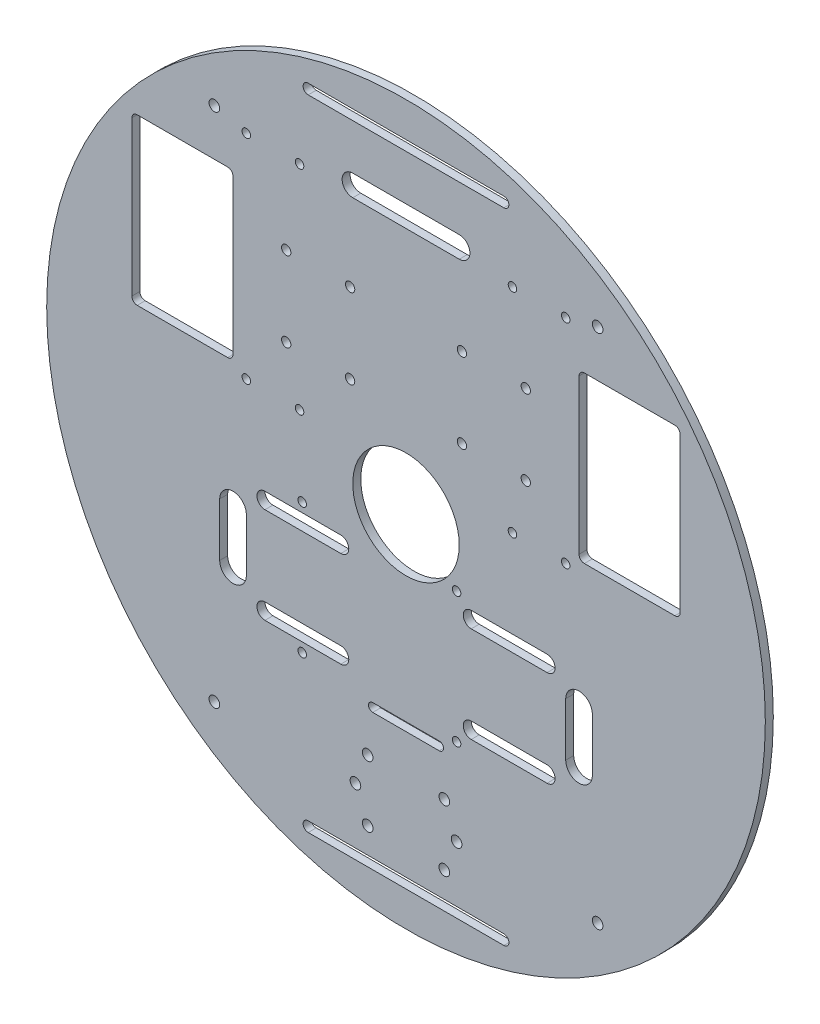
from build123d import *

# Parameters (mm, degrees)
SKETCH_1_R          = 135
SKETCH_1_R_2        = 2
SKETCH_1_W          = 38
SKETCH_1_H          = 62
SKETCH_1_R_3        = 1.75
EXTRUDE_1_DEPTH     = 3
FILLET_1_R          = 2
SKETCH_2_R          = 20
SKETCH_2_R_2        = 2
SKETCH_2_R_3        = 1.6
CUT_EXTRUDE_1_DEPTH = 10


with BuildPart() as part:
    # 草图1 → 凸台-拉伸1 (new body)
    with BuildSketch(Plane.XY):
        Circle(SKETCH_1_R)
        with Locations((-14.4, -108.494845224)):
            Circle(SKETCH_1_R_2, mode=Mode.SUBTRACT)
        with Locations((-19, -96.994845224)):
            Circle(SKETCH_1_R_2, mode=Mode.SUBTRACT)
        with Locations((-14.4, -85.494845224)):
            Circle(SKETCH_1_R_2, mode=Mode.SUBTRACT)
        with Locations((14.4, -108.494845224)):
            Circle(SKETCH_1_R_2, mode=Mode.SUBTRACT)
        with Locations((14.4, -85.494845224)):
            Circle(SKETCH_1_R_2, mode=Mode.SUBTRACT)
        with Locations((19, -96.994845224)):
            Circle(SKETCH_1_R_2, mode=Mode.SUBTRACT)
        with Locations((-84, 48.497422612)):
            Rectangle(SKETCH_1_W, SKETCH_1_H, mode=Mode.SUBTRACT)
        with Locations((-45, 33.497422612)):
            Circle(SKETCH_1_R_3, mode=Mode.SUBTRACT)
        with Locations((-21, 33.497422612)):
            Circle(SKETCH_1_R_3, mode=Mode.SUBTRACT)
        with Locations((-45, 63.497422612)):
            Circle(SKETCH_1_R_3, mode=Mode.SUBTRACT)
        with Locations((-21, 63.497422612)):
            Circle(SKETCH_1_R_3, mode=Mode.SUBTRACT)
        with Locations((21, 33.497422612)):
            Circle(SKETCH_1_R_3, mode=Mode.SUBTRACT)
        with Locations((45, 33.497422612)):
            Circle(SKETCH_1_R_3, mode=Mode.SUBTRACT)
        with Locations((21, 63.497422612)):
            Circle(SKETCH_1_R_3, mode=Mode.SUBTRACT)
        with Locations((45, 63.497422612)):
            Circle(SKETCH_1_R_3, mode=Mode.SUBTRACT)
        with Locations((84, 48.497422612)):
            Rectangle(SKETCH_1_W, SKETCH_1_H, mode=Mode.SUBTRACT)
    extrude(amount=EXTRUDE_1_DEPTH)

    # 圆角1
    fillet_1_edges = [part.edges().sort_by_distance(p)[0] for p in [
        (103, 79.497422612, 1.5),
        (65, 79.497422612, 1.5),
        (65, 17.497422612, 1.5),
        (103, 17.497422612, 1.5),
        (-65, 17.497422612, 1.5),
        (-103, 17.497422612, 1.5),
        (-103, 79.497422612, 1.5),
        (-65, 79.497422612, 1.5),
    ]]
    fillet(fillet_1_edges, radius=FILLET_1_R)

    # 草图2 → 切除-拉伸1 (cut)
    with BuildSketch(Plane.XY.offset(3)):
        Circle(SKETCH_2_R)
        with Locations((-72, 97)):
            Circle(SKETCH_2_R_2)
        with Locations((72, 97)):
            Circle(SKETCH_2_R_2)
        with Locations((72, -97)):
            Circle(SKETCH_2_R_2)
        with Locations((-72, -97)):
            Circle(SKETCH_2_R_2)
        with Locations((-60, 94)):
            Circle(SKETCH_2_R_3)
        with Locations((-60, 14)):
            Circle(SKETCH_2_R_3)
        with Locations((-40, 94)):
            Circle(SKETCH_2_R_3)
        with Locations((-40, 14)):
            Circle(SKETCH_2_R_3)
        with Locations((60, 14)):
            Circle(SKETCH_2_R_3)
        with Locations((60, 94)):
            Circle(SKETCH_2_R_3)
        with Locations((40, 94)):
            Circle(SKETCH_2_R_3)
        with Locations((40, 14)):
            Circle(SKETCH_2_R_3)
        with Locations((-39, -15.5)):
            Circle(SKETCH_2_R_3)
        with Locations((19, -15.5)):
            Circle(SKETCH_2_R_3)
        with Locations((-39, -64.5)):
            Circle(SKETCH_2_R_3)
        with Locations((19, -64.5)):
            Circle(SKETCH_2_R_3)
        with BuildLine():
            Line((24.505636669, -55), (53, -55))
            ThreePointArc((53, -55), (56, -58), (53, -61))
            Line((53, -61), (24.505636669, -61))
            ThreePointArc((24.505636669, -61), (21.505636669, -58), (24.505636669, -55))
        make_face()
        with BuildLine():
            Line((-53, -19), (-24.505636669, -19))
            ThreePointArc((-24.505636669, -19), (-21.505636669, -22), (-24.505636669, -25))
            Line((-24.505636669, -25), (-53, -25))
            ThreePointArc((-53, -25), (-56, -22), (-53, -19))
        make_face()
        with BuildLine():
            Line((-53, -61), (-24.505636669, -61))
            ThreePointArc((-24.505636669, -61), (-21.505636669, -58), (-24.505636669, -55))
            Line((-24.505636669, -55), (-53, -55))
            ThreePointArc((-53, -55), (-56, -58), (-53, -61))
        make_face()
        with BuildLine():
            Line((24.505636669, -25), (53, -25))
            ThreePointArc((53, -25), (56, -22), (53, -19))
            Line((53, -19), (24.505636669, -19))
            ThreePointArc((24.505636669, -19), (21.505636669, -22), (24.505636669, -25))
        make_face()
        with BuildLine():
            Line((-70, -30), (-70, -50))
            ThreePointArc((-70, -50), (-65, -55), (-60, -50))
            Line((-60, -50), (-60, -30))
            ThreePointArc((-60, -30), (-65, -25), (-70, -30))
        make_face()
        with BuildLine():
            Line((60, -30), (60, -50))
            ThreePointArc((60, -50), (65, -55), (70, -50))
            Line((70, -50), (70, -30))
            ThreePointArc((70, -30), (65, -25), (60, -30))
        make_face()
        with BuildLine():
            Line((-36.755588957, 121.9), (36.755588957, 121.9))
            ThreePointArc((36.755588957, 121.9), (38.655588957, 120), (36.755588957, 118.1))
            Line((36.755588957, 118.1), (-36.755588957, 118.1))
            ThreePointArc((-36.755588957, 118.1), (-38.655588957, 120), (-36.755588957, 121.9))
        make_face()
        with BuildLine():
            Line((-36.755588957, -118.1), (36.755588957, -118.1))
            ThreePointArc((36.755588957, -118.1), (38.655588957, -120), (36.755588957, -121.9))
            Line((36.755588957, -121.9), (-36.755588957, -121.9))
            ThreePointArc((-36.755588957, -121.9), (-38.655588957, -120), (-36.755588957, -118.1))
        make_face()
        with BuildLine():
            Line((12.5, -70.7), (-12.5, -70.7))
            ThreePointArc((-12.5, -70.7), (-14.1, -69.1), (-12.5, -67.5))
            Line((-12.5, -67.5), (12.5, -67.5))
            ThreePointArc((12.5, -67.5), (14.1, -69.1), (12.5, -70.7))
        make_face()
        with BuildLine():
            Line((20, 101), (-20, 101))
            ThreePointArc((-20, 101), (-24, 97), (-20, 93))
            Line((-20, 93), (20, 93))
            ThreePointArc((20, 93), (24, 97), (20, 101))
        make_face()
    extrude(amount=-CUT_EXTRUDE_1_DEPTH, mode=Mode.SUBTRACT)


solid = part.part
